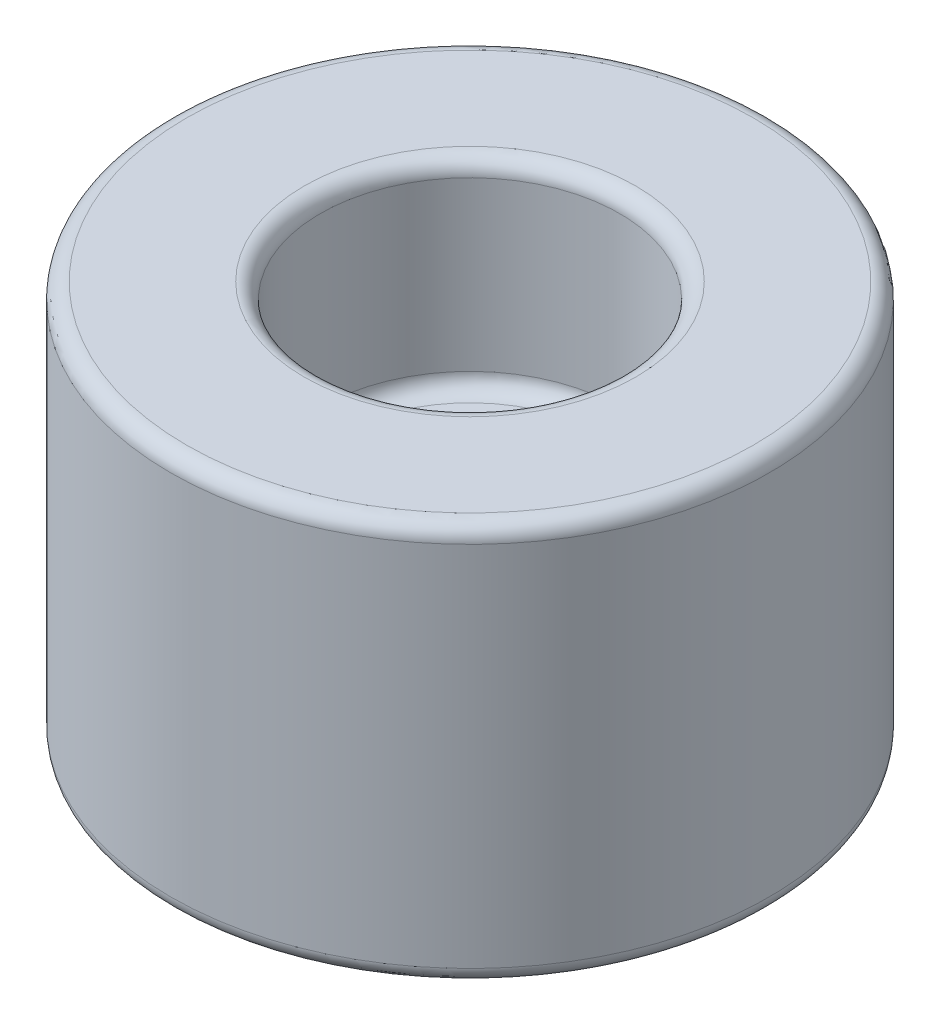
from build123d import *

# Parameters (mm, degrees)
FILLET1_R = 0.508


with BuildPart() as part:
    # Sketch1 → Revolve1 (revolve)
    with BuildSketch(Plane(origin=(0, 0, 0), x_dir=(0, 0, -1), z_dir=(1, 0, 0))):
        Polygon((1.7859375, 6.35), (4.7625, 6.35), (4.7625, 12.7), (9.525, 12.7), (9.525, 0), (1.7859375, 0), align=None)
    revolve(axis=Axis((0, 0, 0), (0, 1, 0)))

    # Fillet1
    fillet1_edges = [part.edges().sort_by_distance(p)[0] for p in [
        (0, 0, 1.7859375),
        (0, 6.35, 1.7859375),
        (0, 6.35, 4.7625),
        (0, 12.7, 4.7625),
        (0, 0, 9.525),
        (0, 12.7, 9.525),
    ]]
    fillet(fillet1_edges, radius=FILLET1_R)


solid = part.part
